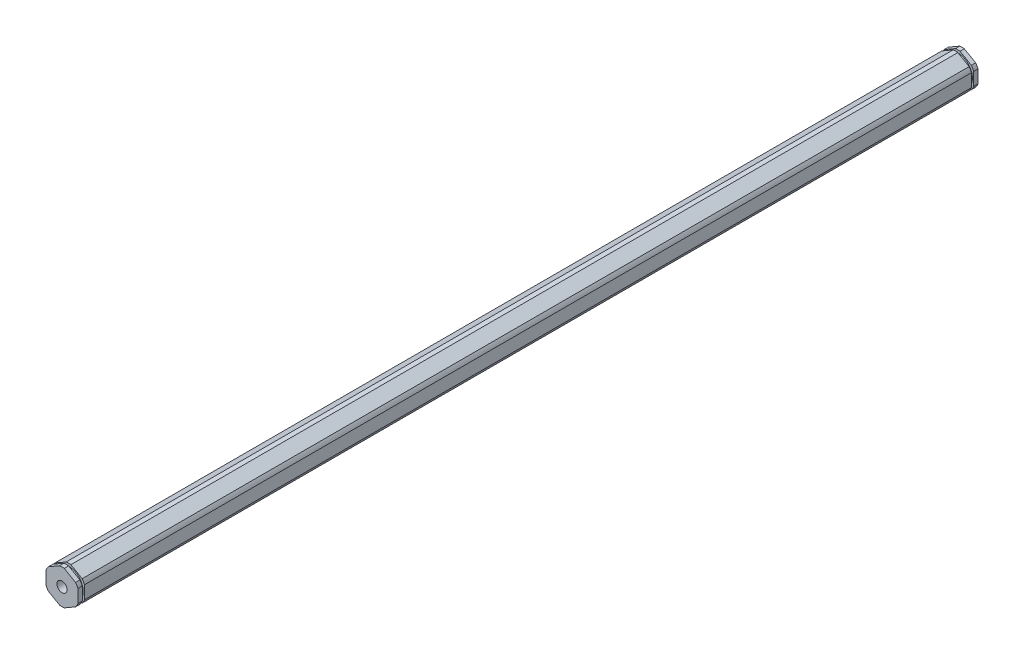
from build123d import *

# Parameters (mm, degrees)
BOSS_EXTRUDE1_DEPTH                  = 178.8795
F_10_32_TAPPED_HOLE1_D               = 4.0386
F_10_32_TAPPED_HOLE1_DEPTH           = 16.34744
F_10_32_TAPPED_HOLE1_TIP             = 1.213317848
F_10_32_TAPPED_HOLE1_ON_FACE_2_D     = 4.0386
F_10_32_TAPPED_HOLE1_ON_FACE_2_DEPTH = 16.34744
F_10_32_TAPPED_HOLE1_ON_FACE_2_TIP   = 1.213317848
SKETCH5_W                            = 0.889
SKETCH5_H                            = 1.0033


with BuildPart() as part:
    # Sketch1 → Boss-Extrude1 (new, symmetric)
    with BuildSketch(Plane.XY):
        with BuildLine():
            ThreePointArc((0.93173274, 6.79441227), (0, 6.858), (-0.93173274, 6.79441227))
            Line((-0.93173274, 6.79441227), (-5.41826726, 4.204110358))
            ThreePointArc((-5.41826726, 4.204110358), (-5.939202219, 3.429), (-6.35, 2.590301913))
            Line((-6.35, 2.590301913), (-6.35, -2.590301913))
            ThreePointArc((-6.35, -2.590301913), (-5.939202219, -3.429), (-5.41826726, -4.204110358))
            Line((-5.41826726, -4.204110358), (-0.93173274, -6.79441227))
            ThreePointArc((-0.93173274, -6.79441227), (0, -6.858), (0.93173274, -6.79441227))
            Line((0.93173274, -6.79441227), (5.41826726, -4.204110358))
            ThreePointArc((5.41826726, -4.204110358), (5.939202219, -3.429), (6.35, -2.590301913))
            Line((6.35, -2.590301913), (6.35, 2.590301913))
            ThreePointArc((6.35, 2.590301913), (5.939202219, 3.429), (5.41826726, 4.204110358))
            Line((5.41826726, 4.204110358), (0.93173274, 6.79441227))
        make_face()
    extrude(amount=BOSS_EXTRUDE1_DEPTH, both=True)

    # #10-32 Tapped Hole1
    with Locations(Plane.XY.offset(178.8795)):
        with Locations((0, 0)):
            Hole(F_10_32_TAPPED_HOLE1_D / 2, depth=F_10_32_TAPPED_HOLE1_DEPTH)
            with Locations((0, 0, -(F_10_32_TAPPED_HOLE1_DEPTH + F_10_32_TAPPED_HOLE1_TIP / 2))):  # 118° drill point
                Cone(0, F_10_32_TAPPED_HOLE1_D / 2, F_10_32_TAPPED_HOLE1_TIP, mode=Mode.SUBTRACT)

    # #10-32 Tapped Hole1 on face 2
    with Locations(Plane(origin=(0, 0, -178.8795), x_dir=(-1, 0, 0), z_dir=(0, 0, -1))):
        with Locations((0, 0)):
            Hole(F_10_32_TAPPED_HOLE1_ON_FACE_2_D / 2, depth=F_10_32_TAPPED_HOLE1_ON_FACE_2_DEPTH)
            with Locations((0, 0, -(F_10_32_TAPPED_HOLE1_ON_FACE_2_DEPTH + F_10_32_TAPPED_HOLE1_ON_FACE_2_TIP / 2))):  # 118° drill point
                Cone(0, F_10_32_TAPPED_HOLE1_ON_FACE_2_D / 2, F_10_32_TAPPED_HOLE1_ON_FACE_2_TIP, mode=Mode.SUBTRACT)

    # Sketch5 → Cut-Revolve1 (revolve, cut)
    with BuildSketch(Plane(origin=(0, 0, 0), x_dir=(0, 0, -1), z_dir=(1, 0, 0))):
        with Locations((-176.7205, 6.35635)):
            Rectangle(SKETCH5_W, SKETCH5_H)
    cut_revolve1 = revolve(axis=Axis((0, 0, 165.047176272), (0, 0, -1)), mode=Mode.SUBTRACT)

    # Mirror1: Cut-Revolve1 across plane
    add(cut_revolve1.mirror(Plane.XY), mode=Mode.SUBTRACT)


solid = part.part
